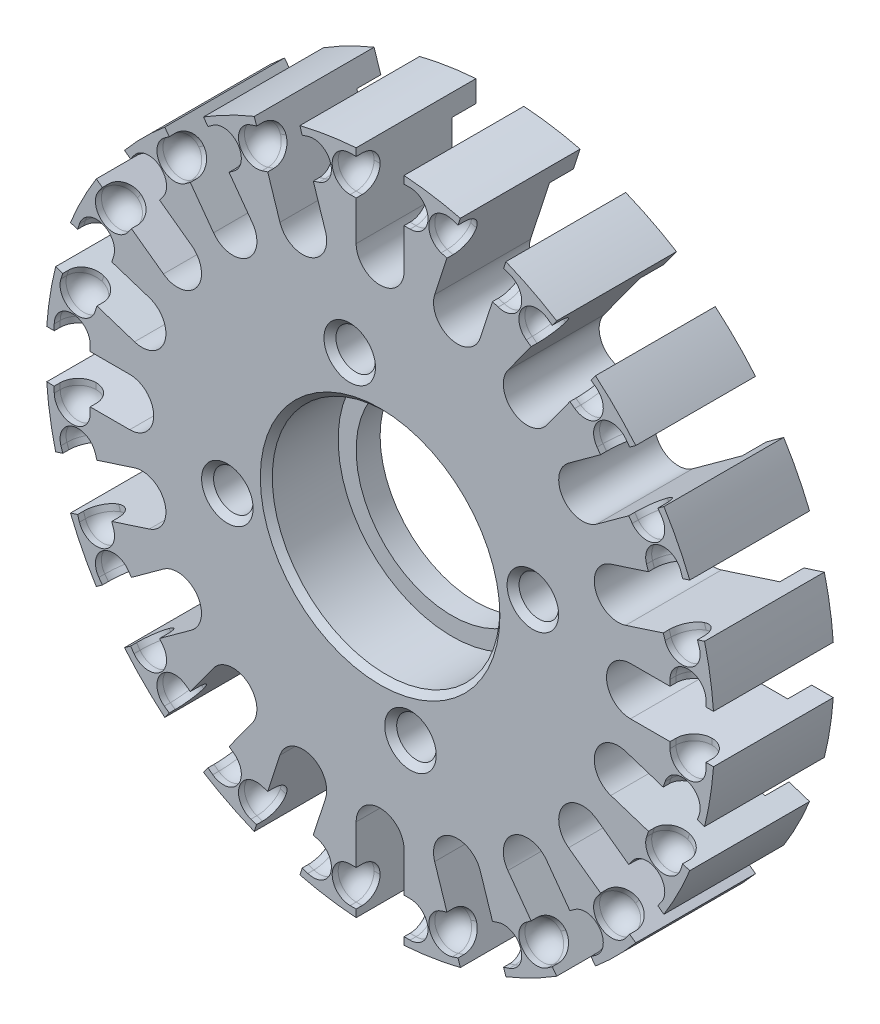
from build123d import *

# Parameters (mm, degrees)
SKETCH_1_R                       = 27.9
EXTRUDE_1_DEPTH                  = 10
SKETCH_10_R                      = 8
CUT_EXTRUDE_7_DEPTH              = 10
SKETCH_6_R                       = 26.1
CUT_EXTRUDE_6_DEPTH              = 2
SKETCH_2_R                       = 9.5
CUT_EXTRUDE_2_DEPTH              = 6
SKETCH_3_R                       = 1.65
CUT_EXTRUDE_3_DEPTH              = 10
PATTERN_CIRCULAR_1_COUNT         = 4
CUT_EXTRUDE_START                = -10
CUT_EXTRUDE_5_DEPTH              = 10
PATTERN_CIRCULAR_3_COUNT         = 20
CHAMFER_1_SIZE                   = 0.5
CUT_EXTRUDE_10_DEPTH             = 2
FILLET_3_R                       = 1.5
PATTERN_CIRCULAR_6_COUNT         = 20
FILLET_3_OF_PATTERN_CIRCULAR_6_R = 1.5
SKETCH_19_R                      = 0.75
CUT_EXTRUDE_1_DEPTH              = 6
PATTERN_CIRCULAR_7_COUNT         = 4


with BuildPart() as part:
    # 草图1 → 拉伸1 (new body)
    with BuildSketch(Plane.XY):
        Circle(SKETCH_1_R)
    extrude(amount=EXTRUDE_1_DEPTH)

    # 草图10 → 拉伸7 (cut)
    with BuildSketch(Plane.XY.offset(10)):
        Circle(SKETCH_10_R)
    extrude(amount=-CUT_EXTRUDE_7_DEPTH, mode=Mode.SUBTRACT)

    # 草图6 → 拉伸6 (cut)
    with BuildSketch(Plane(origin=(0, 0, 0), x_dir=(-1, 0, 0), z_dir=(0, 0, -1))):
        Circle(SKETCH_6_R)
    extrude(amount=-CUT_EXTRUDE_6_DEPTH, mode=Mode.SUBTRACT)

    # 草图2 → 拉伸2 (cut)
    with BuildSketch(Plane.XY.offset(10)):
        Circle(SKETCH_2_R)
    extrude(amount=-CUT_EXTRUDE_2_DEPTH, mode=Mode.SUBTRACT)

    # 草图3 → 拉伸3 (cut)
    with BuildSketch(Plane.XY.offset(10)):
        with Locations((-2.536174186, 12.750208645)):
            Circle(SKETCH_3_R)
    cut_extrude_3 = extrude(amount=-CUT_EXTRUDE_3_DEPTH, mode=Mode.SUBTRACT)

    # 阵列(圆周)1: 拉伸3 ×4 about axis
    pattern_circular_1_axis = Axis((0, 0, 0), (0, 0, 1))
    for i in range(1, PATTERN_CIRCULAR_1_COUNT):
        add(cut_extrude_3.rotate(pattern_circular_1_axis, i * 360 / PATTERN_CIRCULAR_1_COUNT), mode=Mode.SUBTRACT)

    # 草图5 → 拉伸5 (cut)
    with BuildSketch(Plane.XY.offset(10).offset(CUT_EXTRUDE_START)):
        with BuildLine():
            Line((-20.9, 2), (-27.828223084, 2))
            ThreePointArc((-27.828223084, 2), (-27.9, 0), (-27.828223084, -2))
            Line((-27.828223084, -2), (-20.9, -2))
            ThreePointArc((-20.9, -2), (-18.9, 0), (-20.9, 2))
        make_face()
    cut_extrude_5 = extrude(amount=CUT_EXTRUDE_5_DEPTH, mode=Mode.SUBTRACT)

    # 阵列(圆周)3: 拉伸5 ×20 about axis
    pattern_circular_3_axis = Axis((0, 0, 0), (0, 0, 1))
    for i in range(1, PATTERN_CIRCULAR_3_COUNT):
        add(cut_extrude_5.rotate(pattern_circular_3_axis, i * 360 / PATTERN_CIRCULAR_3_COUNT), mode=Mode.SUBTRACT)

    # 倒角1
    chamfer_1_edges = [part.edges().sort_by_distance(p)[0] for p in [
        (-9.5, 0, 10),
        (-4.186174186, 12.750208645, 10),
        (-12.750208645, -4.186174186, 10),
        (4.186174186, -12.750208645, 10),
        (12.750208645, 4.186174186, 10),
    ]]
    chamfer(chamfer_1_edges, length=CHAMFER_1_SIZE)

    # 草图15 → 拉伸10 (cut)
    with BuildSketch(Plane.XY.offset(10)):
        with BuildLine():
            Line((-27.2, 2.5), (-27.2, -2.5))
            ThreePointArc((-27.2, -2.5), (-25.7, -4), (-24.2, -2.5))
            Line((-24.2, -2.5), (-24.2, 2.5))
            ThreePointArc((-24.2, 2.5), (-25.7, 4), (-27.2, 2.5))
        make_face()
    cut_extrude_10 = extrude(amount=-CUT_EXTRUDE_10_DEPTH, mode=Mode.SUBTRACT)

    # 圆角3
    fillet_3_edges = [part.edges().sort_by_distance(p)[0] for p in [
        (-24.2, -2.25, 8),
        (-24.2, 2.25, 8),
        (-27.2, -2.25, 8),
        (-27.2, 2.25, 8),
        (-25.7, -4, 8),
        (-25.7, 4, 8),
    ]]
    fillet(fillet_3_edges, radius=FILLET_3_R - 0.0001)  # a hair under: the kernel refuses the full size

    # 阵列(圆周)6: 拉伸10 ×20 about axis
    pattern_circular_6_axis = Axis((0, 0, 0), (0, 0, 1))
    for i in range(1, PATTERN_CIRCULAR_6_COUNT):
        add(cut_extrude_10.rotate(pattern_circular_6_axis, i * 360 / PATTERN_CIRCULAR_6_COUNT), mode=Mode.SUBTRACT)

    # 圆角3 of 阵列(圆周)6
    fillet_3_of_pattern_circular_6_edges = [part.edges().sort_by_distance(p)[0] for p in [
        (-22.320279457, -9.618088426, 8),
        (-23.710855932, -5.338334102, 8),
        (-25.173449006, -10.545139409, 8),
        (-26.564025481, -6.265385085, 8),
        (-23.206084491, -11.745962821, 8),
        (-25.678220446, -4.13751069, 8),
        (-18.255694446, -16.044691343, 8),
        (-20.900728082, -12.404114868, 8),
        (-20.682745429, -17.8080471, 8),
        (-23.327779065, -14.167470625, 8),
        (-18.440595746, -18.342148961, 8),
        (-23.142877765, -11.870013006, 8),
        (-12.404114868, -20.900728082, 8),
        (-16.044691343, -18.255694446, 8),
        (-14.167470625, -23.327779065, 8),
        (-17.8080471, -20.682745429, 8),
        (-11.870013006, -23.142877765, 8),
        (-18.342148961, -18.440595746, 8),
        (-5.338334102, -23.710855932, 8),
        (-9.618088426, -22.320279457, 8),
        (-6.265385085, -26.564025481, 8),
        (-10.545139409, -25.173449006, 8),
        (-4.13751069, -25.678220446, 8),
        (-11.745962821, -23.206084491, 8),
        (2.25, -24.2, 8),
        (-2.25, -24.2, 8),
        (2.25, -27.2, 8),
        (-2.25, -27.2, 8),
        (4, -25.7, 8),
        (-4, -25.7, 8),
        (9.618088426, -22.320279457, 8),
        (5.338334102, -23.710855932, 8),
        (10.545139409, -25.173449006, 8),
        (6.265385085, -26.564025481, 8),
        (11.745962821, -23.206084491, 8),
        (4.13751069, -25.678220446, 8),
        (16.044691343, -18.255694446, 8),
        (12.404114868, -20.900728082, 8),
        (17.8080471, -20.682745429, 8),
        (14.167470625, -23.327779065, 8),
        (18.342148961, -18.440595746, 8),
        (11.870013006, -23.142877765, 8),
        (20.900728082, -12.404114868, 8),
        (18.255694446, -16.044691343, 8),
        (23.327779065, -14.167470625, 8),
        (20.682745429, -17.8080471, 8),
        (23.142877765, -11.870013006, 8),
        (18.440595746, -18.342148961, 8),
        (23.710855932, -5.338334102, 8),
        (22.320279457, -9.618088426, 8),
        (26.564025481, -6.265385085, 8),
        (25.173449006, -10.545139409, 8),
        (25.678220446, -4.13751069, 8),
        (23.206084491, -11.745962821, 8),
        (24.2, 2.25, 8),
        (24.2, -2.25, 8),
        (27.2, 2.25, 8),
        (27.2, -2.25, 8),
        (25.7, 4, 8),
        (25.7, -4, 8),
        (22.320279457, 9.618088426, 8),
        (23.710855932, 5.338334102, 8),
        (25.173449006, 10.545139409, 8),
        (26.564025481, 6.265385085, 8),
        (23.206084491, 11.745962821, 8),
        (25.678220446, 4.13751069, 8),
        (18.255694446, 16.044691343, 8),
        (20.900728082, 12.404114868, 8),
        (20.682745429, 17.8080471, 8),
        (23.327779065, 14.167470625, 8),
        (18.440595746, 18.342148961, 8),
        (23.142877765, 11.870013006, 8),
        (12.404114868, 20.900728082, 8),
        (16.044691343, 18.255694446, 8),
        (14.167470625, 23.327779065, 8),
        (17.8080471, 20.682745429, 8),
        (11.870013006, 23.142877765, 8),
        (18.342148961, 18.440595746, 8),
        (5.338334102, 23.710855932, 8),
        (9.618088426, 22.320279457, 8),
        (6.265385085, 26.564025481, 8),
        (10.545139409, 25.173449006, 8),
        (4.13751069, 25.678220446, 8),
        (11.745962821, 23.206084491, 8),
        (-2.25, 24.2, 8),
        (2.25, 24.2, 8),
        (-2.25, 27.2, 8),
        (2.25, 27.2, 8),
        (-4, 25.7, 8),
        (4, 25.7, 8),
        (-9.618088426, 22.320279457, 8),
        (-5.338334102, 23.710855932, 8),
        (-10.545139409, 25.173449006, 8),
        (-6.265385085, 26.564025481, 8),
        (-11.745962821, 23.206084491, 8),
        (-4.13751069, 25.678220446, 8),
        (-16.044691343, 18.255694446, 8),
        (-12.404114868, 20.900728082, 8),
        (-17.8080471, 20.682745429, 8),
        (-14.167470625, 23.327779065, 8),
        (-18.342148961, 18.440595746, 8),
        (-11.870013006, 23.142877765, 8),
        (-20.900728082, 12.404114868, 8),
        (-18.255694446, 16.044691343, 8),
        (-23.327779065, 14.167470625, 8),
        (-20.682745429, 17.8080471, 8),
        (-23.142877765, 11.870013006, 8),
        (-18.440595746, 18.342148961, 8),
        (-23.710855932, 5.338334102, 8),
        (-22.320279457, 9.618088426, 8),
        (-26.564025481, 6.265385085, 8),
        (-25.173449006, 10.545139409, 8),
        (-25.678220446, 4.13751069, 8),
        (-23.206084491, 11.745962821, 8),
    ]]
    fillet(fillet_3_of_pattern_circular_6_edges, radius=FILLET_3_OF_PATTERN_CIRCULAR_6_R - 0.0001)  # a hair under: the kernel refuses the full size

    # 草图19 → 切除-拉伸1 (cut)
    with BuildSketch(Plane(origin=(0, 0, 2), x_dir=(-1, 0, 0), z_dir=(0, 0, -1))):
        with Locations((-16.89985207, 16.89985207)):
            Circle(SKETCH_19_R)
    cut_extrude_1 = extrude(amount=-CUT_EXTRUDE_1_DEPTH, mode=Mode.SUBTRACT)

    # 阵列(圆周)7: 切除-拉伸1 ×4 about axis
    pattern_circular_7_axis = Axis((0, 0, 0), (0, 0, 1))
    for i in range(1, PATTERN_CIRCULAR_7_COUNT):
        add(cut_extrude_1.rotate(pattern_circular_7_axis, i * 360 / PATTERN_CIRCULAR_7_COUNT), mode=Mode.SUBTRACT)


solid = part.part
